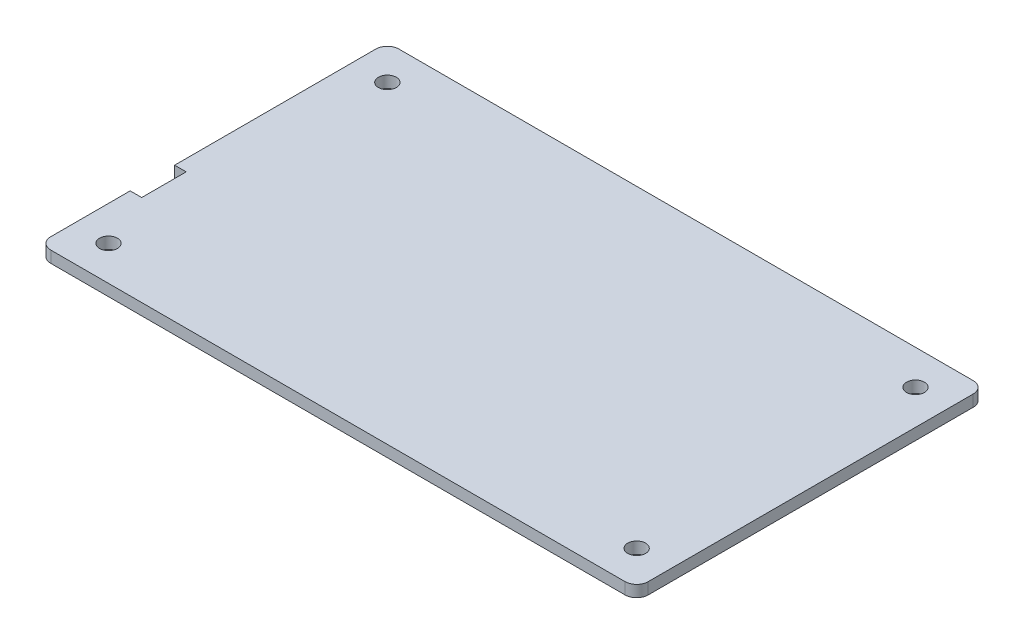
from build123d import *

# Parameters (mm, degrees)
SKETCH_1_R      = 1.55
EXTRUDE_1_DEPTH = 2


with BuildPart() as part:
    # 草图1 → 凸台-拉伸1 (new body)
    with BuildSketch(Plane(origin=(0, 0, 0), x_dir=(1, 0, 0), z_dir=(0, 1, 0))):
        with BuildLine():
            Line((97.46, -4), (97.46, 52.29))
            ThreePointArc((97.46, 52.29), (96.874213562, 53.704213562), (95.46, 54.29))
            Line((95.46, 54.29), (-4, 54.29))
            ThreePointArc((-4, 54.29), (-5.414213562, 53.704213562), (-6, 52.29))
            Line((-6, 52.29), (-6, 17.45))
            Line((-6, 17.45), (-4, 17.45))
            Line((-4, 17.45), (-4, 9.75))
            Line((-4, 9.75), (-6, 9.75))
            Line((-6, 9.75), (-6, -4))
            ThreePointArc((-6, -4), (-5.414213562, -5.414213562), (-4, -6))
            Line((-4, -6), (95.46, -6))
            ThreePointArc((95.46, -6), (96.874213562, -5.414213562), (97.46, -4))
        make_face()
        Circle(SKETCH_1_R, mode=Mode.SUBTRACT)
        with Locations((91.46, 0)):
            Circle(SKETCH_1_R, mode=Mode.SUBTRACT)
        with Locations((0, 48.29)):
            Circle(SKETCH_1_R, mode=Mode.SUBTRACT)
        with Locations((91.46, 48.29)):
            Circle(SKETCH_1_R, mode=Mode.SUBTRACT)
    extrude(amount=EXTRUDE_1_DEPTH)


solid = part.part
